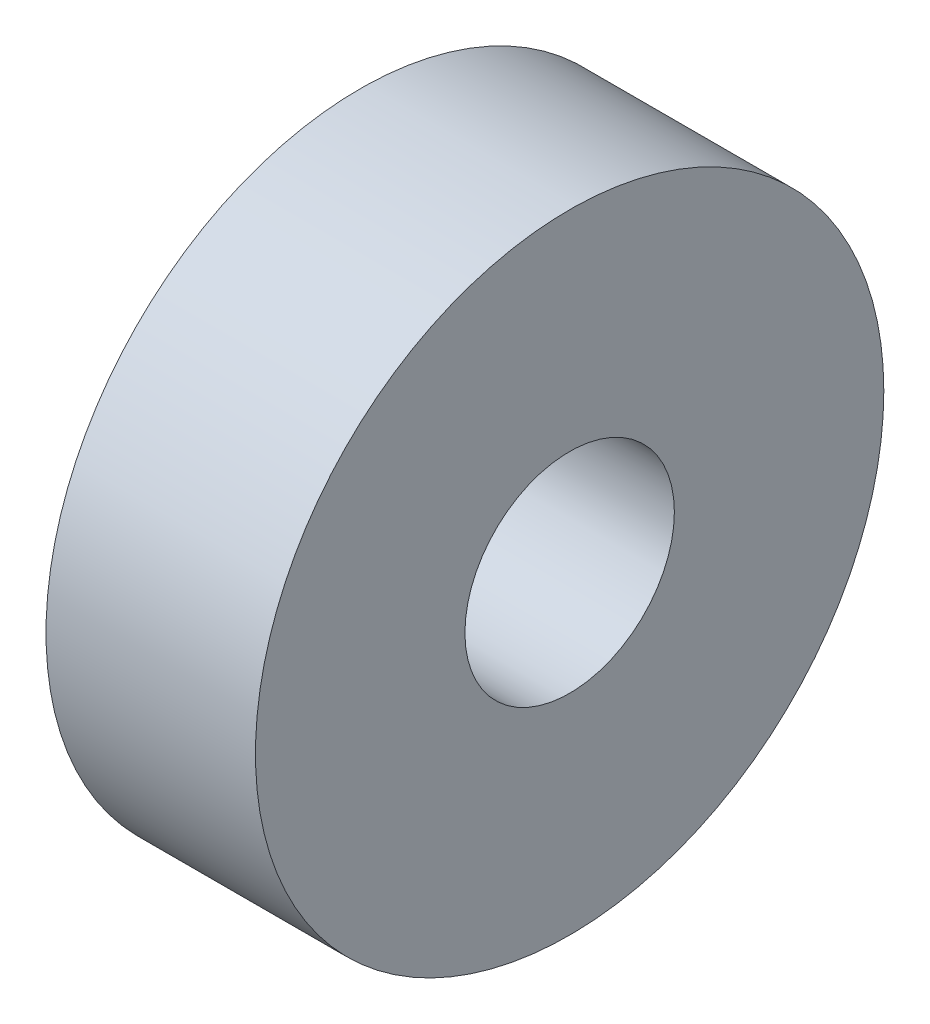
from build123d import *

# Parameters (mm, degrees)
SKETCH1_W = 9.525
SKETCH1_H = 9.525


with BuildPart() as part:
    # Sketch1 → Revolve1 (revolve)
    with BuildSketch(Plane.XY):
        with Locations((4.7625, 9.525)):
            Rectangle(SKETCH1_W, SKETCH1_H)
    revolve(axis=Axis((0, 0, 0), (-1, 0, 0)))


solid = part.part
